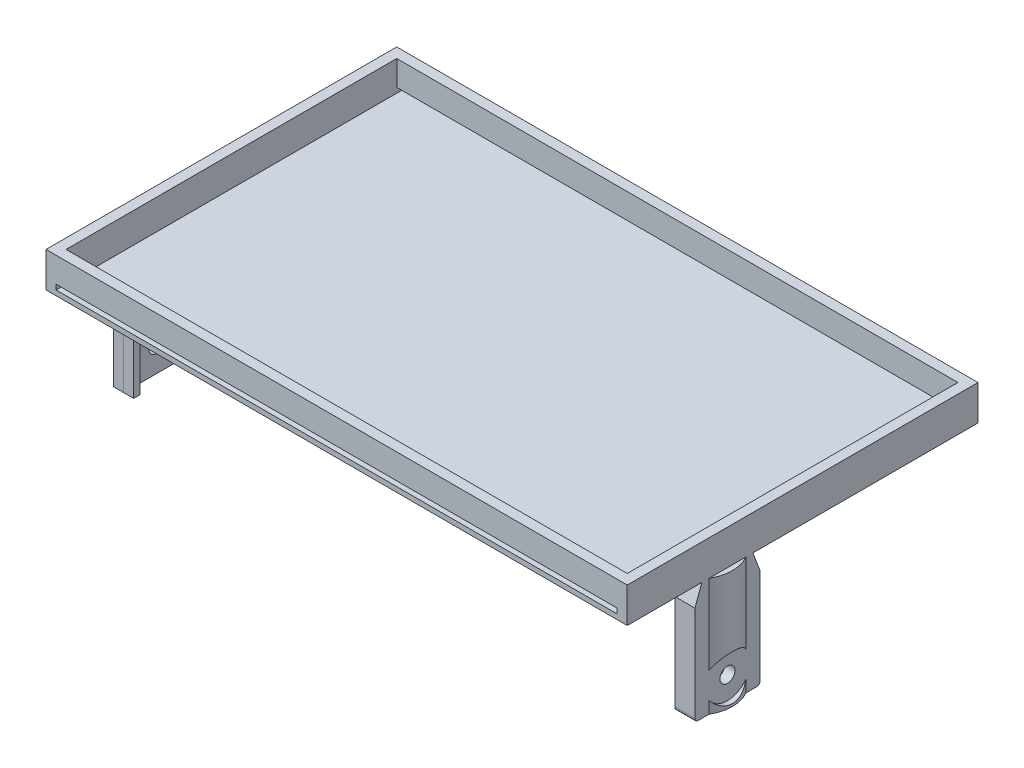
from build123d import *

# Parameters (mm, degrees)
DODANIE_WYCI_GNI_CIE1_DEPTH     = 2
DODANIE_WYCI_GNI_CIE2_DEPTH     = 2
DODANIE_WYCI_GNI_CIE3_START     = -114
DODANIE_WYCI_GNI_CIE3_DEPTH     = 2
DODANIE_WYCI_GNI_CIE4_START     = -112
DODANIE_WYCI_GNI_CIE4_DEPTH     = 2
DODANIE_WYCI_GNI_CIE4_2_DEPTH   = 2
WYTNIJ_WYCI_GNI_CIE1_DEPTH      = 118.556369457
WYTNIJ_WYCI_GNI_CIE1_DEPTH_BACK = 118.556369457
SZKIC4_R                        = 1.5
ZAOKR_GLENIE18_SIZE             = 0.7
WYTNIJ_WYCI_GNI_CIE2_START      = 2
SZKIC4_3_R                      = 4.5
SZKIC4_3_R_2                    = 1.5
WYTNIJ_WYCI_GNI_CIE2_DEPTH      = 10
WYTNIJ_WYCI_GNI_CIE3_START      = -116
SZKIC4_4_R                      = 4.5
SZKIC4_4_R_2                    = 1.5
WYTNIJ_WYCI_GNI_CIE3_DEPTH      = 2
SZKIC9_W                        = 112
SZKIC9_H                        = 66
DODANIE_WYCI_GNI_CIE5_DEPTH     = 7
SZKIC9_4_W                      = 112
SZKIC9_4_H                      = 66
DODANIE_WYCI_GNI_CIE6_DEPTH     = 1
SZKIC11_W                       = 112
SZKIC11_H                       = 1
WYTNIJ_WYCI_GNI_CIE4_DEPTH      = 95.515871844


with BuildPart() as part:
    # Wyciągnięcie po ścieżce6: sweep along a path in Szkic8
    with BuildLine(Plane.XY) as wyci_gni_cie_po_cie_ce6_path:
        Line((-57, 0), (-57, -23.5))
    # Szkic3 → Wyciągnięcie po ścieżce6 (sweep)
    with BuildSketch(Plane(origin=(0, 0, 0), x_dir=(1, 0, 0), z_dir=(0, 1, 0))):
        with BuildLine():
            Line((56, 5), (57, 5))
            ThreePointArc((57, 5), (59, 0), (57, -5))
            Line((57, -5), (56, -5))
            Line((56, -5), (56, 5))
        make_face()
        with BuildLine():
            Line((-56, -5), (-57, -5))
            ThreePointArc((-57, -5), (-59, 0), (-57, 5))
            Line((-57, 5), (-56, 5))
            Line((-56, 5), (-56, -5))
        make_face()
    sweep(path=wyci_gni_cie_po_cie_ce6_path.line)

    # Dodanie-wyciągnięcie1: read off the stored shape, not the designer's step
    # Dodanie-wyciągnięcie1 outline → Dodanie-wyciągnięcie1 (add)
    with BuildSketch(Plane(origin=(56, 0, 0), x_dir=(0, 0, -1), z_dir=(1, 0, 0))):
        Polygon((-6.5, -3.743926041), (-6.5, -23.5), (6.5, -23.5), (6.5, -3.743926041), (5, 0.256073959), (5, 0), (-5, 0), (-5, 0.256073959), align=None)
    extrude(amount=DODANIE_WYCI_GNI_CIE1_DEPTH)

    # Szkic5<3> → Dodanie-wyciągnięcie2 (add)
    with BuildSketch(Plane(origin=(56, 0, 0), x_dir=(0, 0, -1), z_dir=(1, 0, 0))):
        Polygon((6.5, -3.743926041), (5.2, -0.277259374), (5.2, -23.5), (6.5, -23.5), align=None)
        Polygon((-5.2, -0.277259374), (-6.5, -3.743926041), (-6.5, -23.5), (-5.2, -23.5), align=None)
    extrude(amount=-DODANIE_WYCI_GNI_CIE2_DEPTH)


with BuildPart() as body_2:
    # Dodanie-wyciągnięcie3: read off the stored shape, not the designer's step
    # Dodanie-wyciągnięcie3 outline → Dodanie-wyciągnięcie3 (new body)
    with BuildSketch(Plane(origin=(56, 0, 0), x_dir=(0, 0, -1), z_dir=(1, 0, 0)).offset(DODANIE_WYCI_GNI_CIE3_START)):
        Polygon((5, 0.256073959), (5, 0), (-5, 0), (-5, 0.256073959), (-6.5, -3.743926041), (-6.5, -23.5), (6.5, -23.5), (6.5, -3.743926041), align=None)
    extrude(amount=DODANIE_WYCI_GNI_CIE3_DEPTH)


with BuildPart() as body_3:
    # Szkic5<6> → Dodanie-wyciągnięcie4 (new body)
    with BuildSketch(Plane(origin=(56, 0, 0), x_dir=(0, 0, -1), z_dir=(1, 0, 0)).offset(DODANIE_WYCI_GNI_CIE4_START)):
        Polygon((-5.2, -0.277259374), (-6.5, -3.743926041), (-6.5, -23.5), (-5.2, -23.5), align=None)
    extrude(amount=DODANIE_WYCI_GNI_CIE4_DEPTH)


with BuildPart() as body_4:
    # Szkic5<6> → Dodanie-wyci_gni_cie4 2 (new body)
    with BuildSketch(Plane(origin=(56, 0, 0), x_dir=(0, 0, -1), z_dir=(1, 0, 0)).offset(DODANIE_WYCI_GNI_CIE4_START)):
        Polygon((6.5, -3.743926041), (5.2, -0.277259374), (5.2, -23.5), (6.5, -23.5), align=None)
    extrude(amount=DODANIE_WYCI_GNI_CIE4_2_DEPTH)


with BuildPart() as wytnij_wyci_gni_cie1_tool:
    # Szkic4 → Wytnij-wyciągnięcie1 (new, two sides: drawn at the far end of the back side and taken through both)
    with BuildSketch(Plane(origin=(56, 0, 0), x_dir=(0, 0, -1), z_dir=(1, 0, 0)).offset(-WYTNIJ_WYCI_GNI_CIE1_DEPTH_BACK)):
        with Locations((0, -18.5)):
            Circle(SZKIC4_R)
    extrude(amount=WYTNIJ_WYCI_GNI_CIE1_DEPTH + WYTNIJ_WYCI_GNI_CIE1_DEPTH_BACK)


with BuildPart() as part_1:
    add(part.part)

    # Wytnij-wyciągnięcie1: cut by wytnij_wyci_gni_cie1_tool
    add(wytnij_wyci_gni_cie1_tool.part, mode=Mode.SUBTRACT)

    # Zaokrąglenie18
    # a fillet whose section is not a circle: 0.7 mm, written as the material it takes off along each edge
    with BuildSketch(Plane(origin=(59.75, -23.5, 6.5), x_dir=(0, 0, -1), z_dir=(-1, 0, 0)), Plane(origin=(52.25, -23.5, -6.5), x_dir=(0, 0, 1), z_dir=(1, 0, 0))) as zaokr_glenie18_piece_1:
        with BuildLine():
            Bezier((ZAOKR_GLENIE18_SIZE, 0), (0, 0), (0, -ZAOKR_GLENIE18_SIZE), weights=[1, 1, 1])
            Line((0, -ZAOKR_GLENIE18_SIZE), (0, 0))
            Line((0, 0), (ZAOKR_GLENIE18_SIZE, 0))
        make_face()
    extrude(amount=7.5, mode=Mode.SUBTRACT)

    # Szkic4<3> → Wytnij-wyciągnięcie2 (cut)
    with BuildSketch(Plane(origin=(56, 0, 0), x_dir=(0, 0, -1), z_dir=(1, 0, 0)).offset(WYTNIJ_WYCI_GNI_CIE2_START)):
        with Locations((0, -18.5)):
            Circle(SZKIC4_3_R)
        with Locations((0, -18.5)):
            Circle(SZKIC4_3_R_2, mode=Mode.SUBTRACT)
    extrude(amount=WYTNIJ_WYCI_GNI_CIE2_DEPTH, mode=Mode.SUBTRACT)

    # Szkic4<4> → Wytnij-wyciągnięcie3 (cut)
    with BuildSketch(Plane(origin=(56, 0, 0), x_dir=(0, 0, -1), z_dir=(1, 0, 0)).offset(WYTNIJ_WYCI_GNI_CIE3_START)):
        with Locations((0, -18.5)):
            Circle(SZKIC4_4_R)
        with Locations((0, -18.5)):
            Circle(SZKIC4_4_R_2, mode=Mode.SUBTRACT)
    extrude(amount=WYTNIJ_WYCI_GNI_CIE3_DEPTH, mode=Mode.SUBTRACT)



with BuildPart() as body_2_1:
    add(body_2.part)

    # Wytnij-wyciągnięcie1: cut by wytnij_wyci_gni_cie1_tool
    add(wytnij_wyci_gni_cie1_tool.part, mode=Mode.SUBTRACT)


with BuildPart() as part_2:
    add(part_1.part)

    add(body_2_1.part)  # Dodanie-wyciągnięcie5 merges body 2
    # Szkic9 → Dodanie-wyciągnięcie5 (add)
    with BuildSketch(Plane(origin=(0, 0, 0), x_dir=(1, 0, 0), z_dir=(0, 1, 0))):
        Polygon((58, -5), (58, 50), (-58, 50), (-58, -5), (-58, -20), (58, -20), align=None)
        with Locations((0, 15)):
            Rectangle(SZKIC9_W, SZKIC9_H, mode=Mode.SUBTRACT)
    extrude(amount=DODANIE_WYCI_GNI_CIE5_DEPTH)

    # Szkic9<4> → Dodanie-wyciągnięcie6 (add)
    with BuildSketch(Plane(origin=(0, 0, 0), x_dir=(1, 0, 0), z_dir=(0, 1, 0))):
        with Locations((0, 15)):
            Rectangle(SZKIC9_4_W, SZKIC9_4_H)
    extrude(amount=DODANIE_WYCI_GNI_CIE6_DEPTH)

    # Szkic11 → Wytnij-wyciągnięcie4 (cut, through all)
    with BuildSketch(Plane(origin=(0, 0, -50), x_dir=(-1, 0, 0), z_dir=(0, 0, -1))):
        with Locations((0, 1.5)):
            Rectangle(SZKIC11_W, SZKIC11_H)
    extrude(amount=-WYTNIJ_WYCI_GNI_CIE4_DEPTH, mode=Mode.SUBTRACT)


solid = Compound([body_3.part, body_4.part, part_2.part])
